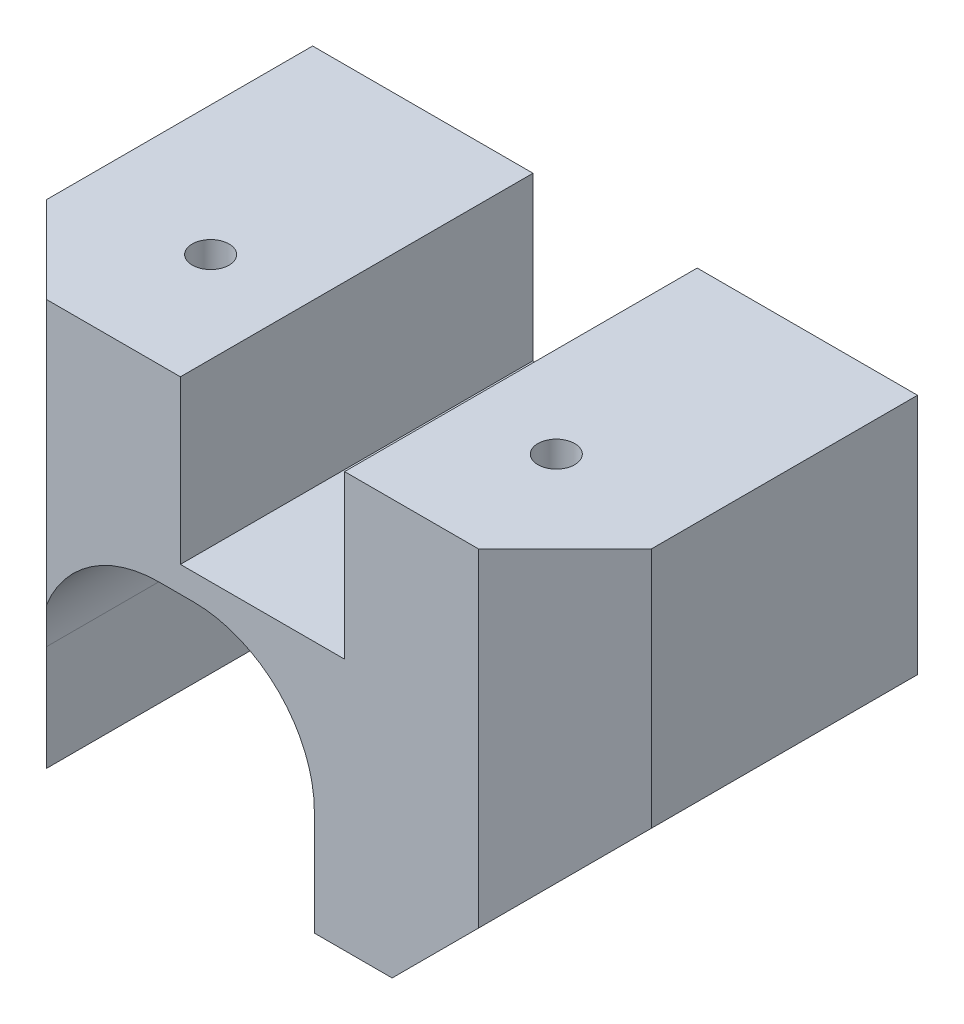
from build123d import *

# Parameters (mm, degrees)
SKETCH1_W                = 44.45
SKETCH1_H                = 25.908
BOSS_EXTRUDE1_DEPTH      = 30.48
SIDECHAMFER_SIZE         = 12.7
BACKCHAMFERS_SIZE        = 6.35
SKETCH2_W                = 12.065
SKETCH2_H                = 11.938
LINACTSLOT_DEPTH         = 46.762489978
MOUTINGHOLES_D           = 2.7051
MOUTINGHOLES_DEPTH       = 14.478
MOUTINGHOLES_TIP         = 0.81269403
MOTORSLOT_DEPTH          = 46.762489978
MOTORMOUNTINGHOLES_D     = 2.2606
MOTORMOUNTINGHOLES_DEPTH = 8.89
MOTORMOUNTINGHOLES_TIP   = 0.679152758


with BuildPart() as part:
    # Sketch1 → Boss-Extrude1 (new body)
    with BuildSketch(Plane(origin=(0, 0, 0), x_dir=(1, 0, 0), z_dir=(0, 1, 0))):
        Rectangle(SKETCH1_W, SKETCH1_H)
    extrude(amount=BOSS_EXTRUDE1_DEPTH)

    # SideChamfer
    sidechamfer_edges = [part.edges().sort_by_distance(p)[0] for p in [
        (22.225, 0, 0),
    ]]
    chamfer(sidechamfer_edges, length=SIDECHAMFER_SIZE)

    # BackChamfers
    backchamfers_edges = [part.edges().sort_by_distance(p)[0] for p in [
        (-22.225, 15.24, 12.954),
        (22.225, 21.59, 12.954),
    ]]
    chamfer(backchamfers_edges, length=BACKCHAMFERS_SIZE)

    # Sketch2 → LinActSlot (cut, through all)
    with BuildSketch(Plane.XY.offset(12.954)):
        with Locations((0, 24.511)):
            Rectangle(SKETCH2_W, SKETCH2_H)
    extrude(amount=-LINACTSLOT_DEPTH, mode=Mode.SUBTRACT)

    # MoutingHoles
    with Locations(Plane(origin=(14.160350453, 30.48, 8.373414988), x_dir=(-1, 0, 0), z_dir=(0, 1, 0))):
        with Locations((1.460350453, -4.309414988), (26.860350453, -4.309414988)):
            Hole(MOUTINGHOLES_D / 2, depth=MOUTINGHOLES_DEPTH)
            with Locations((0, 0, -(MOUTINGHOLES_DEPTH + MOUTINGHOLES_TIP / 2))):  # 118° drill point
                Cone(0, MOUTINGHOLES_D / 2, MOUTINGHOLES_TIP, mode=Mode.SUBTRACT)

    # Sketch5 → MotorSlot (cut, through all)
    with BuildSketch(Plane(origin=(0, 0, -12.954), x_dir=(-1, 0, 0), z_dir=(0, 0, -1))):
        with BuildLine():
            Line((16.51, 0), (-3.81, 0))
            Line((-3.81, 0), (-3.81, 7.747))
            ThreePointArc((-3.81, 7.747), (-1.206179285, 14.033179285), (5.08, 16.637))
            Line((5.08, 16.637), (7.62, 16.637))
            ThreePointArc((7.62, 16.637), (13.906179285, 14.033179285), (16.51, 7.747))
            Line((16.51, 7.747), (16.51, 0))
        make_face()
    extrude(amount=-MOTORSLOT_DEPTH, mode=Mode.SUBTRACT)

    # MotorMountingHoles
    with Locations(Plane(origin=(0, 0, -12.954), x_dir=(-1, 0, 0), z_dir=(0, 0, -1))):
        with Locations((18.8468, 6.35), (-6.1468, 6.35)):
            Hole(MOTORMOUNTINGHOLES_D / 2, depth=MOTORMOUNTINGHOLES_DEPTH)
            with Locations((0, 0, -(MOTORMOUNTINGHOLES_DEPTH + MOTORMOUNTINGHOLES_TIP / 2))):  # 118° drill point
                Cone(0, MOTORMOUNTINGHOLES_D / 2, MOTORMOUNTINGHOLES_TIP, mode=Mode.SUBTRACT)


solid = part.part
